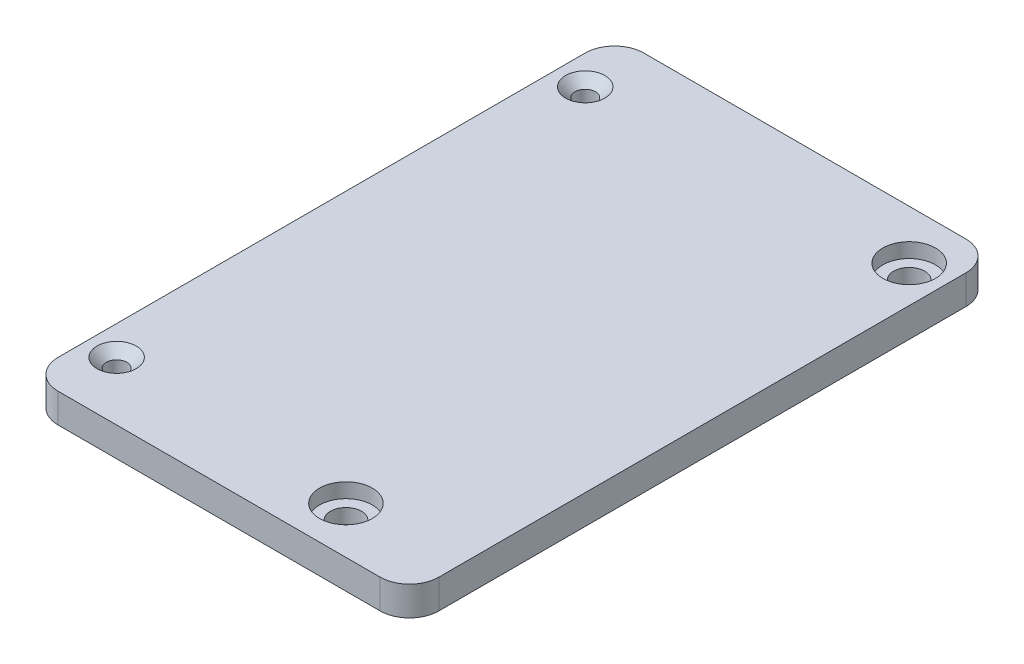
from build123d import *

# Parameters (mm, degrees)
SKETCH2_W           = 65
SKETCH2_H           = 100
SKETCH2_R           = 1.75
SKETCH2_R_2         = 2.65
BOSS_EXTRUDE1_DEPTH = 5
SKETCH3_R           = 4.5
CUT_EXTRUDE1_DEPTH  = 2.5
FILLET1_R           = 5
CHAMFER1_SIZE       = 1.6


with BuildPart() as part:
    # Sketch2 → Boss-Extrude1 (new body)
    with BuildSketch(Plane(origin=(0, 0, 0), x_dir=(1, 0, 0), z_dir=(0, 1, 0))):
        Rectangle(SKETCH2_W, SKETCH2_H)
        with Locations((-27.5, 40)):
            Circle(SKETCH2_R, mode=Mode.SUBTRACT)
        with Locations((-27.5, -40)):
            Circle(SKETCH2_R, mode=Mode.SUBTRACT)
        with Locations((26.23, 41.58)):
            Circle(SKETCH2_R_2, mode=Mode.SUBTRACT)
        with Locations((13.65, -42)):
            Circle(SKETCH2_R_2, mode=Mode.SUBTRACT)
    extrude(amount=BOSS_EXTRUDE1_DEPTH)

    # Sketch3 → Cut-Extrude1 (cut)
    with BuildSketch(Plane(origin=(0, 5, 0), x_dir=(1, 0, 0), z_dir=(0, 1, 0))):
        with Locations((26.23, 41.58)):
            Circle(SKETCH3_R)
        with Locations((13.65, -42)):
            Circle(SKETCH3_R)
    extrude(amount=-CUT_EXTRUDE1_DEPTH, mode=Mode.SUBTRACT)

    # Fillet1
    fillet1_edges = [part.edges().sort_by_distance(p)[0] for p in [
        (-32.5, 2.5, 50),
        (-32.5, 2.5, -50),
        (32.5, 2.5, -50),
        (32.5, 2.5, 50),
    ]]
    fillet(fillet1_edges, radius=FILLET1_R)

    # Chamfer1
    chamfer1_edges = [part.edges().sort_by_distance(p)[0] for p in [
        (-29.25, 5, 40),
        (-29.25, 5, -40),
    ]]
    chamfer(chamfer1_edges, length=CHAMFER1_SIZE)


solid = part.part
